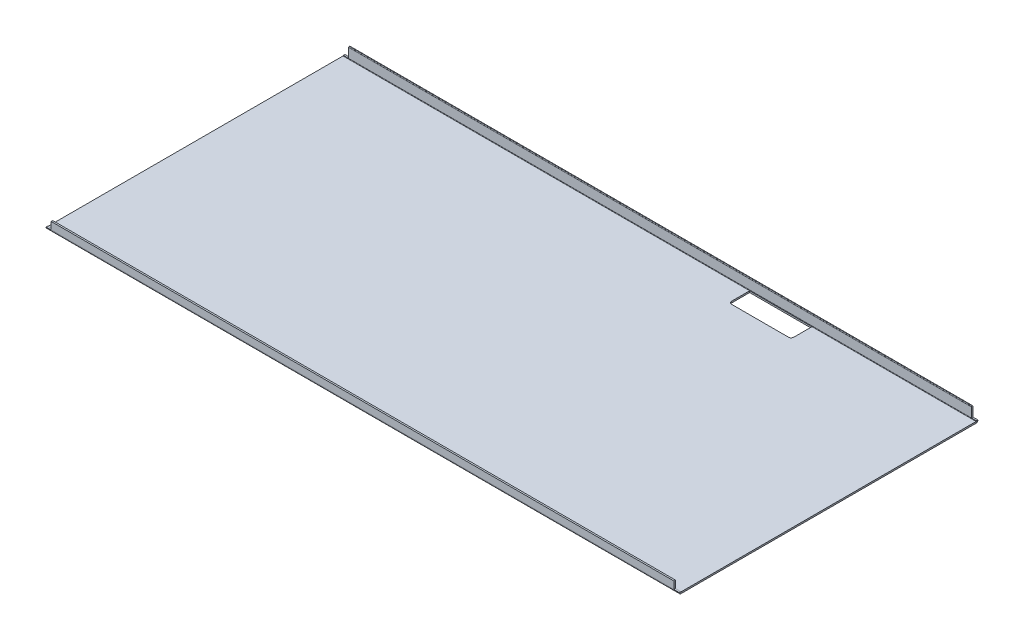
from build123d import *

# Parameters (mm, degrees)
BASE_FLANGE1_DEPTH = 1220
SKETCH6_W          = 10
SKETCH6_H          = 19.2634
CUT_EXTRUDE1_DEPTH = 1350.246604201
CUT_EXTRUDE2_REACH = 1300.516
FILLET1_R          = 1


# Sheet-metal steps are written as plain solids
with BuildPart() as part:
    # Sketch1 → Base-Flange1 (new body)
    with BuildSketch(Plane(origin=(0, 0, 0), x_dir=(0, 0, -1), z_dir=(1, 0, 0))):
        with BuildLine():
            Line((-128.767123288, 0.95890411), (-128.767123288, -13.30449589))
            ThreePointArc((-128.767123288, -13.30449589), (-128.551378143, -13.825350745), (-128.030523288, -14.04109589))
            Line((-128.030523288, -14.04109589), (440.496276712, -14.04109589))
            ThreePointArc((440.496276712, -14.04109589), (441.017131567, -13.825350745), (441.232876712, -13.30449589))
            Line((441.232876712, -13.30449589), (441.232876712, 5.95890411))
            Line((441.232876712, 5.95890411), (444.232876712, 5.95890411))
            Line((444.232876712, 5.95890411), (444.232876712, -13.30449589))
            ThreePointArc((444.232876712, -13.30449589), (443.138451911, -15.946671089), (440.496276712, -17.04109589))
            Line((440.496276712, -17.04109589), (-128.030523288, -17.04109589))
            ThreePointArc((-128.030523288, -17.04109589), (-130.672698486, -15.946671089), (-131.767123288, -13.30449589))
            Line((-131.767123288, -13.30449589), (-131.767123288, 0.95890411))
            Line((-131.767123288, 0.95890411), (-128.767123288, 0.95890411))
        make_face()
    extrude(amount=BASE_FLANGE1_DEPTH)

    # Sketch6 → Cut-Extrude1 (cut, through all)
    with BuildSketch(Plane(origin=(0, 0, -444.232876712), x_dir=(-1, 0, 0), z_dir=(0, 0, -1))):
        with Locations((-1215, -3.67279589)):
            Rectangle(SKETCH6_W, SKETCH6_H)
        with Locations((-5, -3.67279589)):
            Rectangle(SKETCH6_W, SKETCH6_H)
    extrude(amount=-CUT_EXTRUDE1_DEPTH, mode=Mode.SUBTRACT)

    # Sketch8 → Cut-Extrude2 (cut, up to next)
    with BuildSketch(Plane(origin=(0, -14.04109589, 0), x_dir=(1, 0, 0), z_dir=(0, 1, 0)), mode=Mode.PRIVATE) as cut_extrude2_sk1:
        with BuildLine():
            Line((903.689592114, 440.496276712), (783.689592114, 440.496276712))
            Line((783.689592114, 440.496276712), (783.689592114, 405.496276712))
            ThreePointArc((783.689592114, 405.496276712), (785.154058208, 401.960742806), (788.689592114, 400.496276712))
            Line((788.689592114, 400.496276712), (898.689592114, 400.496276712))
            ThreePointArc((898.689592114, 400.496276712), (902.22512602, 401.960742806), (903.689592114, 405.496276712))
            Line((903.689592114, 405.496276712), (903.689592114, 440.496276712))
        make_face()
    cut_extrude2_tool1 = extrude(cut_extrude2_sk1.sketch, amount=-CUT_EXTRUDE2_REACH, mode=Mode.PRIVATE) & part.part
    add(cut_extrude2_tool1.solids().sort_by_distance((843.689592, -14.041096, -420.538583))[0], mode=Mode.SUBTRACT)

    # Fillet1
    fillet1_edges = [part.edges().sort_by_distance(p)[0] for p in [
        (610, 5.95890411, -441.232876712),
        (610, 5.95890411, -444.232876712),
    ]]
    fillet(fillet1_edges, radius=FILLET1_R)


solid = part.part
